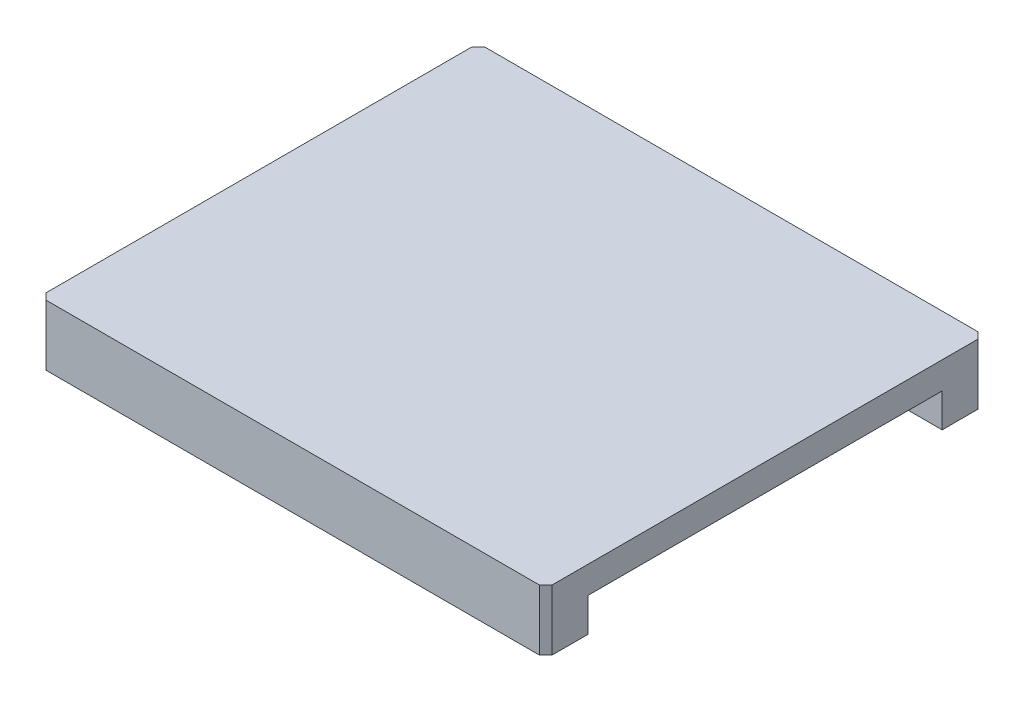
from build123d import *

# Parameters (mm, degrees)
ESTRUSIONE_ESTRUSIONE9_DEPTH = 60
SMUSSO1_SIZE                 = 0.75


with BuildPart() as part:
    # Schizzo16 → Estrusione-Estrusione9 (new body)
    with BuildSketch(Plane(origin=(0, 0, 0), x_dir=(0, 0, -1), z_dir=(1, 0, 0))):
        Polygon((0, 0), (5, 0), (5, 4), (47, 4), (47, 0), (52, 0), (52, 7.2), (0, 7.2), align=None)
    extrude(amount=ESTRUSIONE_ESTRUSIONE9_DEPTH)

    # Smusso1
    smusso1_edges = [part.edges().sort_by_distance(p)[0] for p in [
        (0, 3.6, 0),
        (0, 3.6, -52),
        (60, 3.6, -52),
        (60, 3.6, 0),
    ]]
    chamfer(smusso1_edges, length=SMUSSO1_SIZE)


solid = part.part
